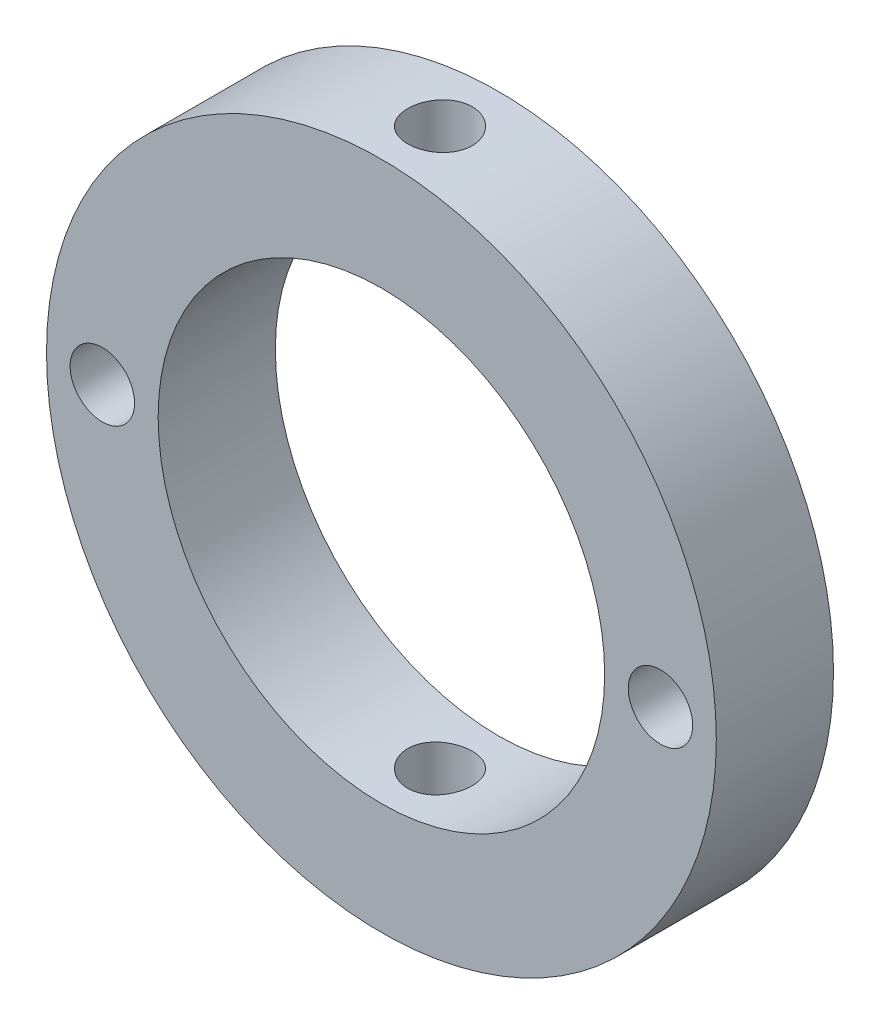
from build123d import *

# Parameters (mm, degrees)
SKETCH1_R           = 28.575
BOSS_EXTRUDE1_DEPTH = 10
SKETCH2_R           = 19.05
CUT_EXTRUDE1_DEPTH  = 42.630052246
SKETCH5_R           = 2.75
CUT_EXTRUDE2_DEPTH  = 65.673434461
SKETCH6_R           = 2.75
CUT_EXTRUDE3_DEPTH  = 42.630052407


with BuildPart() as part:
    # Sketch1 → Boss-Extrude1 (new body)
    with BuildSketch(Plane.XY):
        Circle(SKETCH1_R)
    extrude(amount=BOSS_EXTRUDE1_DEPTH)

    # Sketch2 → Cut-Extrude1 (cut, through all)
    with BuildSketch(Plane.XY.offset(10)):
        Circle(SKETCH2_R)
    extrude(amount=-CUT_EXTRUDE1_DEPTH, mode=Mode.SUBTRACT)

    # Sketch5 → Cut-Extrude2 (cut, through all)
    with BuildSketch(Plane(origin=(0, 28.575, 0), x_dir=(1, 0, 0), z_dir=(0, 1, 0))):
        with Locations((0, -5)):
            Circle(SKETCH5_R)
    extrude(amount=-CUT_EXTRUDE2_DEPTH, mode=Mode.SUBTRACT)

    # Sketch6 → Cut-Extrude3 (cut, through all)
    with BuildSketch(Plane.XY.offset(10)):
        with Locations((-23.8125, 0)):
            Circle(SKETCH6_R)
        with Locations((23.8125, 0)):
            Circle(SKETCH6_R)
    extrude(amount=-CUT_EXTRUDE3_DEPTH, mode=Mode.SUBTRACT)


solid = part.part
